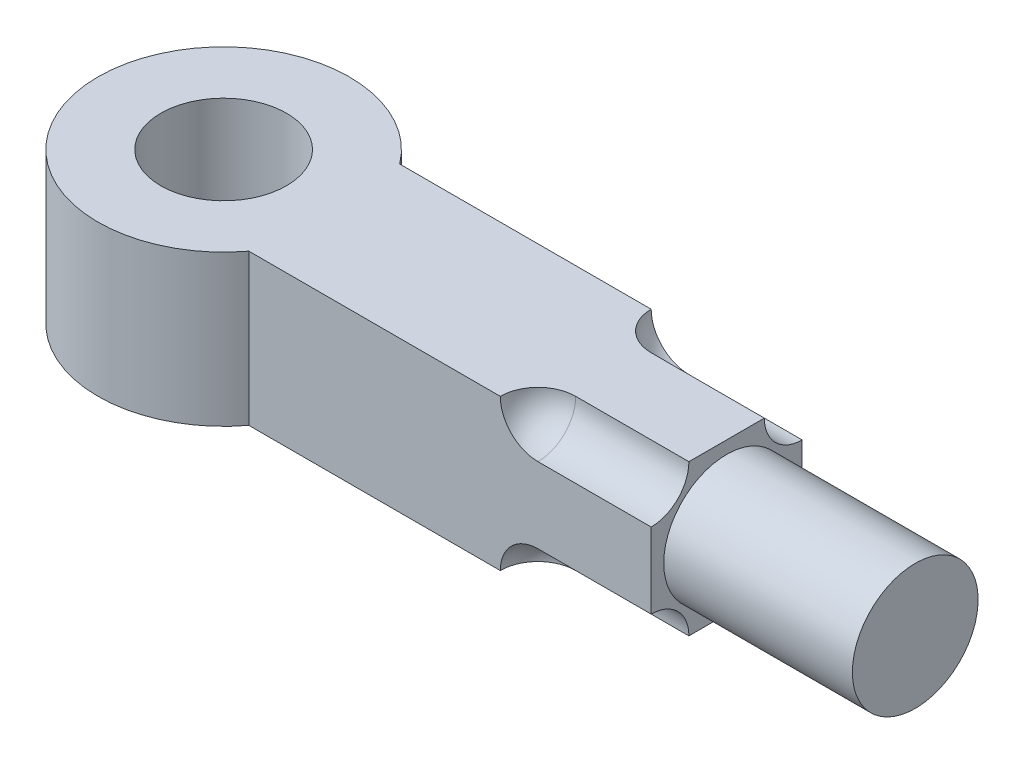
from build123d import *

# Parameters (mm, degrees)
BOSS_EXTRUDE1_DEPTH     = 24
SKETCH3_R               = 10
BOSS_EXTRUDE2_DEPTH     = 30
CUT_EXTRUDE1_DEPTH      = 77.655071587
CUT_EXTRUDE1_DEPTH_BACK = 77.655071587
SKETCH4_R               = 10
CUT_EXTRUDE2_DEPTH      = 105.76640683
CUT_EXTRUDE2_DEPTH_BACK = 24
SKETCH7_R               = 6
FILLET3_R               = 6


with BuildPart() as part:
    # Sketch2 → Boss-Extrude1 (new body)
    with BuildSketch(Plane(origin=(0, 0, 0), x_dir=(1, 0, 0), z_dir=(0, 1, 0))):
        with BuildLine():
            Line((-24, 12), (40, 12))
            Line((40, 12), (40, -12))
            Line((40, -12), (-24, -12))
            ThreePointArc((-24, -12), (-60, 0), (-24, 12))
        make_face()
    extrude(amount=BOSS_EXTRUDE1_DEPTH)

    # Sketch3 → Boss-Extrude2 (add)
    with BuildSketch(Plane(origin=(40, 0, 0), x_dir=(0, 0, -1), z_dir=(1, 0, 0))):
        with Locations((0, 12)):
            Circle(SKETCH3_R)
    extrude(amount=BOSS_EXTRUDE2_DEPTH)

    # Sketch4 → Cut-Extrude1 (cut, two sides: drawn at the far end of the back side and taken through both)
    with BuildSketch(Plane(origin=(0, 24, 0), x_dir=(1, 0, 0), z_dir=(0, 1, 0)).offset(-CUT_EXTRUDE1_DEPTH_BACK)):
        with Locations(Location((-40, 0, 0), (0, 0, 270))):
            Circle(SKETCH4_R)
    extrude(amount=CUT_EXTRUDE1_DEPTH + CUT_EXTRUDE1_DEPTH_BACK, mode=Mode.SUBTRACT)

    # Sketch7 → Cut-Extrude2 (cut, two sides: drawn at the far end of the back side and taken through both)
    with BuildSketch(Plane(origin=(40, 0, 0), x_dir=(0, 0, -1), z_dir=(1, 0, 0)).offset(-CUT_EXTRUDE2_DEPTH_BACK)):
        with Locations((-12, 24)):
            Circle(SKETCH7_R)
        with Locations((12, 24)):
            Circle(SKETCH7_R)
        with Locations((12, 0)):
            Circle(SKETCH7_R)
        with Locations((-12, 0)):
            Circle(SKETCH7_R)
    extrude(amount=CUT_EXTRUDE2_DEPTH + CUT_EXTRUDE2_DEPTH_BACK, mode=Mode.SUBTRACT)

    # Fillet3
    fillet3_edges = [part.edges().sort_by_distance(p)[0] for p in [
        (16, 4.242640687, -7.757359313),
        (16, 4.242640687, 7.757359313),
        (16, 19.757359313, -7.757359313),
        (16, 19.757359313, 7.757359313),
    ]]
    fillet(fillet3_edges, radius=FILLET3_R - 0.0001)  # a hair under: the kernel refuses the full size


solid = part.part
